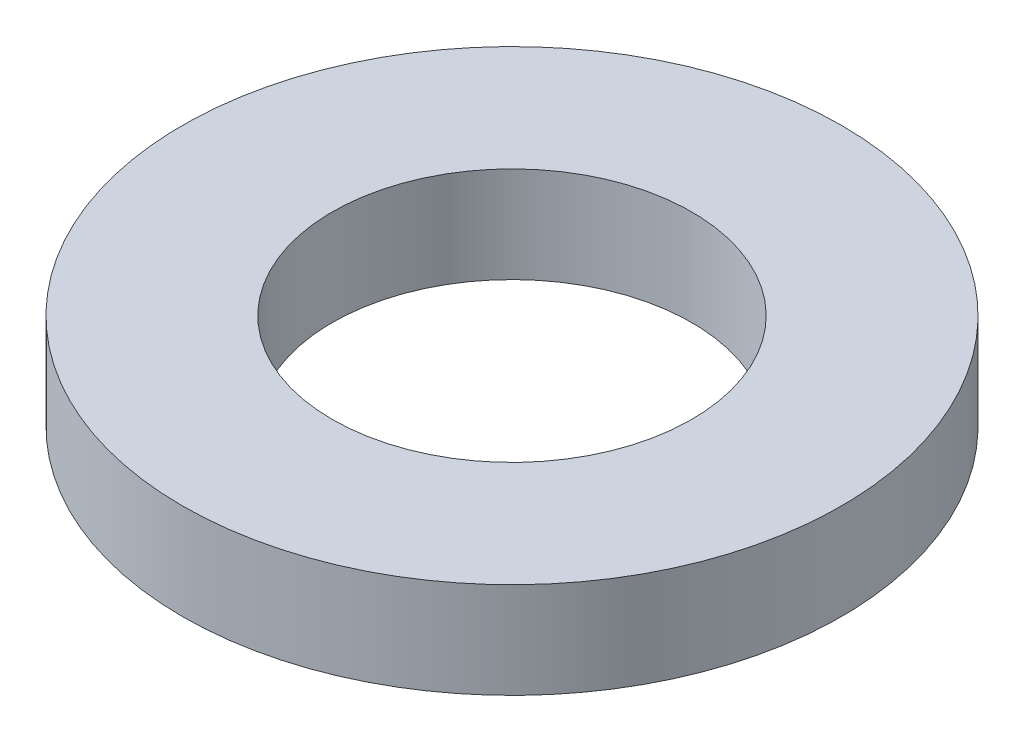
from build123d import *

# Parameters (mm, degrees)
SKETCH1_R           = 82.5
BOSS_EXTRUDE1_DEPTH = 24
SKETCH2_R           = 45
CUT_EXTRUDE1_DEPTH  = 120.115490177


with BuildPart() as part:
    # Sketch1 → Boss-Extrude1 (new body)
    with BuildSketch(Plane(origin=(0, 0, 0), x_dir=(1, 0, 0), z_dir=(0, 1, 0))):
        Circle(SKETCH1_R)
    extrude(amount=BOSS_EXTRUDE1_DEPTH)

    # Sketch2 → Cut-Extrude1 (cut, through all)
    with BuildSketch(Plane(origin=(0, 0, 0), x_dir=(1, 0, 0), z_dir=(0, 1, 0))):
        Circle(SKETCH2_R)
    extrude(amount=CUT_EXTRUDE1_DEPTH, mode=Mode.SUBTRACT)


solid = part.part
